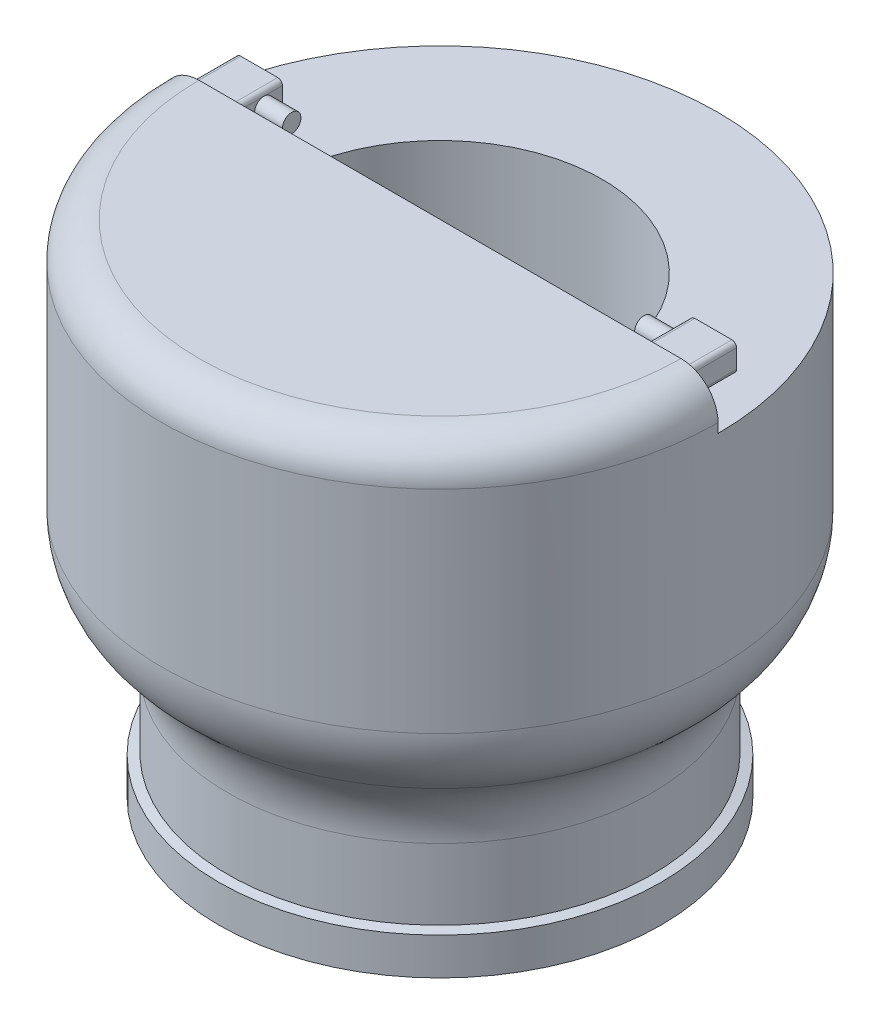
from build123d import *

# Parameters (mm, degrees)
SKETCH10_R              = 10
BOSS_EXTRUDE1_DEPTH     = 5
CUT_EXTRUDE3_DEPTH      = 45
CUT_EXTRUDE3_DEPTH_BACK = 20
CUT_EXTRUDE5_DEPTH      = 5
BOSS_EXTRUDE2_DEPTH     = 5
SKETCH14_R              = 1
BOSS_EXTRUDE3_DEPTH     = 3
BOSS_EXTRUDE4_START     = 3
SKETCH15_R              = 1
BOSS_EXTRUDE4_DEPTH     = 3
CUT_EXTRUDE6_DEPTH      = 10
CUT_EXTRUDE6_DRAFT      = -10
SKETCH18_W              = 50.237541655
SKETCH18_H              = 20.454146011
CUT_EXTRUDE7_DEPTH      = 7
CUT_EXTRUDE7_DRAFT      = -30


with BuildPart() as part:
    # Sketch1 → Revolve1 (revolve)
    with BuildSketch(Plane.XY):
        with BuildLine():
            Line((20.9, 0), (23.871591838, 0))
            Line((23.871591838, 0), (23.871591838, 4))
            Line((23.871591838, 4), (22.9, 4.236662843))
            Line((22.9, 4.236662843), (22.9, 11.874576818))
            ThreePointArc((22.9, 11.874576818), (23.83692213, 16.100759435), (26.472123903, 19.535021249))
            Line((26.472123903, 19.535021249), (26.427876097, 19.497892931))
            ThreePointArc((26.427876097, 19.497892931), (29.06307787, 22.932154745), (30, 27.158337362))
            Line((30, 27.158337362), (30, 50))
            ThreePointArc((30, 50), (28.828427125, 52.828427125), (26, 54))
            Line((26, 54), (0, 54))
            Line((0, 54), (0, 15))
            Line((0, 15), (19.9, 15))
            ThreePointArc((19.9, 15), (20.607106781, 14.707106781), (20.9, 14))
            Line((20.9, 14), (20.9, 0))
        make_face()
    revolve(axis=Axis((0, 0, 0), (0, 1, 0)))

    # Sketch10 → Boss-Extrude1 (add)
    with BuildSketch(Plane(origin=(0, 0, -30), x_dir=(-1, 0, 0), z_dir=(0, 0, -1))):
        with Locations((3.346345887, 38.658337362)):
            Circle(SKETCH10_R)
    extrude(amount=-BOSS_EXTRUDE1_DEPTH)

    # Sketch11 → Cut-Extrude3 (cut, two sides: drawn at the far end of the back side and taken through both)
    with BuildSketch(Plane(origin=(0, 17, 0), x_dir=(1, 0, 0), z_dir=(0, 1, 0)).offset(-CUT_EXTRUDE3_DEPTH_BACK)):
        with BuildLine():
            Line((-17.5, 0), (17.5, 0))
            ThreePointArc((17.5, 0), (0, 17.5), (-17.5, 0))
        make_face()
    extrude(amount=CUT_EXTRUDE3_DEPTH + CUT_EXTRUDE3_DEPTH_BACK, mode=Mode.SUBTRACT)

    # Sketch9 → Cut-Extrude5 (cut)
    with BuildSketch(Plane(origin=(0, 54, 0), x_dir=(1, 0, 0), z_dir=(0, 1, 0))):
        with BuildLine():
            Line((-30, 0), (30, 0))
            ThreePointArc((30, 0), (0, 30), (-30, 0))
        make_face()
    extrude(amount=-CUT_EXTRUDE5_DEPTH, mode=Mode.SUBTRACT)

    # Sketch13 → Boss-Extrude2 (add)
    with BuildSketch(Plane(origin=(0, 0, 0), x_dir=(-1, 0, 0), z_dir=(0, 0, -1))):
        with BuildLine():
            Line((22.5, 53.5), (26.5, 53.5))
            ThreePointArc((26.5, 53.5), (26.853553391, 53.353553391), (27, 53))
            Line((27, 53), (27, 51))
            ThreePointArc((27, 51), (26.853553391, 50.646446609), (26.5, 50.5))
            Line((26.5, 50.5), (22.5, 50.5))
            ThreePointArc((22.5, 50.5), (22.146446609, 50.646446609), (22, 51))
            Line((22, 51), (22, 53))
            ThreePointArc((22, 53), (22.146446609, 53.353553391), (22.5, 53.5))
        make_face()
        with BuildLine():
            Line((-26.5, 53.5), (-22.5, 53.5))
            ThreePointArc((-22.5, 53.5), (-22.146446609, 53.353553391), (-22, 53))
            Line((-22, 53), (-22, 51))
            ThreePointArc((-22, 51), (-22.146446609, 50.646446609), (-22.5, 50.5))
            Line((-22.5, 50.5), (-26.5, 50.5))
            ThreePointArc((-26.5, 50.5), (-26.853553391, 50.646446609), (-27, 51))
            Line((-27, 51), (-27, 53))
            ThreePointArc((-27, 53), (-26.853553391, 53.353553391), (-26.5, 53.5))
        make_face()
    extrude(amount=BOSS_EXTRUDE2_DEPTH)

    # Sketch14 → Boss-Extrude3 (add)
    with BuildSketch(Plane.ZY.offset(-22)):
        with Locations((-3, 52)):
            Circle(SKETCH14_R)
    extrude(amount=BOSS_EXTRUDE3_DEPTH)

    # Sketch15 → Boss-Extrude4 (add)
    with BuildSketch(Plane(origin=(-22, 0, 0), x_dir=(0, 0, -1), z_dir=(1, 0, 0)).offset(BOSS_EXTRUDE4_START)):
        with Locations((3, 52)):
            Circle(SKETCH15_R)
    extrude(amount=-BOSS_EXTRUDE4_DEPTH)


with BuildPart() as cut_extrude6_tool:
    # Sketch17 → Cut-Extrude6 (with draft: the straight prism first)
    with BuildSketch(Plane(origin=(0, 0, 0), x_dir=(-1, 0, 0), z_dir=(0, 0, -1))):
        with BuildLine():
            ThreePointArc((-24.47851765, 47.302362136), (-25.892731213, 46.716575698), (-26.47851765, 45.302362136))
            Line((-26.47851765, 45.302362136), (-26.47851765, 25.01560965))
            ThreePointArc((-26.47851765, 25.01560965), (-25.892731213, 23.601396087), (-24.47851765, 23.01560965))
            Line((-24.47851765, 23.01560965), (25.354900287, 23.01560965))
            ThreePointArc((25.354900287, 23.01560965), (26.769113849, 23.601396087), (27.354900287, 25.01560965))
            Line((27.354900287, 25.01560965), (27.354900287, 45.302362136))
            ThreePointArc((27.354900287, 45.302362136), (26.769113849, 46.716575698), (25.354900287, 47.302362136))
            Line((25.354900287, 47.302362136), (-24.47851765, 47.302362136))
        make_face()
    extrude(amount=-CUT_EXTRUDE6_DEPTH)
    # Cut-Extrude6: the draft: its side faces are tilted about the plane it starts from
    cut_extrude6_sides = [cut_extrude6_tool.faces().sort_by_distance(p)[0] for p in [
        (25.892731213, 46.716575698, 5),
        (26.47851765, 35.158985893, 5),
        (25.892731213, 23.601396087, 5),
        (-0.438191318, 23.01560965, 5),
        (-26.769113849, 23.601396087, 5),
        (-27.354900287, 35.158985893, 5),
        (-26.769113849, 46.716575698, 5),
        (-0.438191318, 47.302362136, 5),
    ]]
    draft(cut_extrude6_sides, Plane(origin=(0, 0, 0), x_dir=(-1, 0, 0), z_dir=(0, 0, -1)), CUT_EXTRUDE6_DRAFT)


with BuildPart() as part_1:
    add(part.part)

    # Cut-Extrude6: cut by cut_extrude6_tool
    add(cut_extrude6_tool.part, mode=Mode.SUBTRACT)


with BuildPart() as cut_extrude7_tool:
    # Sketch18 → Cut-Extrude7 (with draft: the straight prism first)
    with BuildSketch(Plane(origin=(0, 0, 10), x_dir=(-1, 0, 0), z_dir=(0, 0, -1))):
        with Locations((0.403522985, 35.07528913)):
            Rectangle(SKETCH18_W, SKETCH18_H)
    extrude(amount=-CUT_EXTRUDE7_DEPTH)
    # Cut-Extrude7: the draft: its side faces are tilted about the plane it starts from
    cut_extrude7_sides = [cut_extrude7_tool.faces().sort_by_distance(p)[0] for p in [
        (24.715247843, 35.07528913, 13.5),
        (-0.403522984, 24.848216125, 13.5),
        (-25.522293812, 35.07528913, 13.5),
        (-0.403522984, 45.302362136, 13.5),
    ]]
    draft(cut_extrude7_sides, Plane(origin=(0, 0, 10), x_dir=(-1, 0, 0), z_dir=(0, 0, -1)), CUT_EXTRUDE7_DRAFT)


with BuildPart() as part_2:
    add(part_1.part)

    # Cut-Extrude7: cut by cut_extrude7_tool
    add(cut_extrude7_tool.part, mode=Mode.SUBTRACT)


solid = part_2.part
